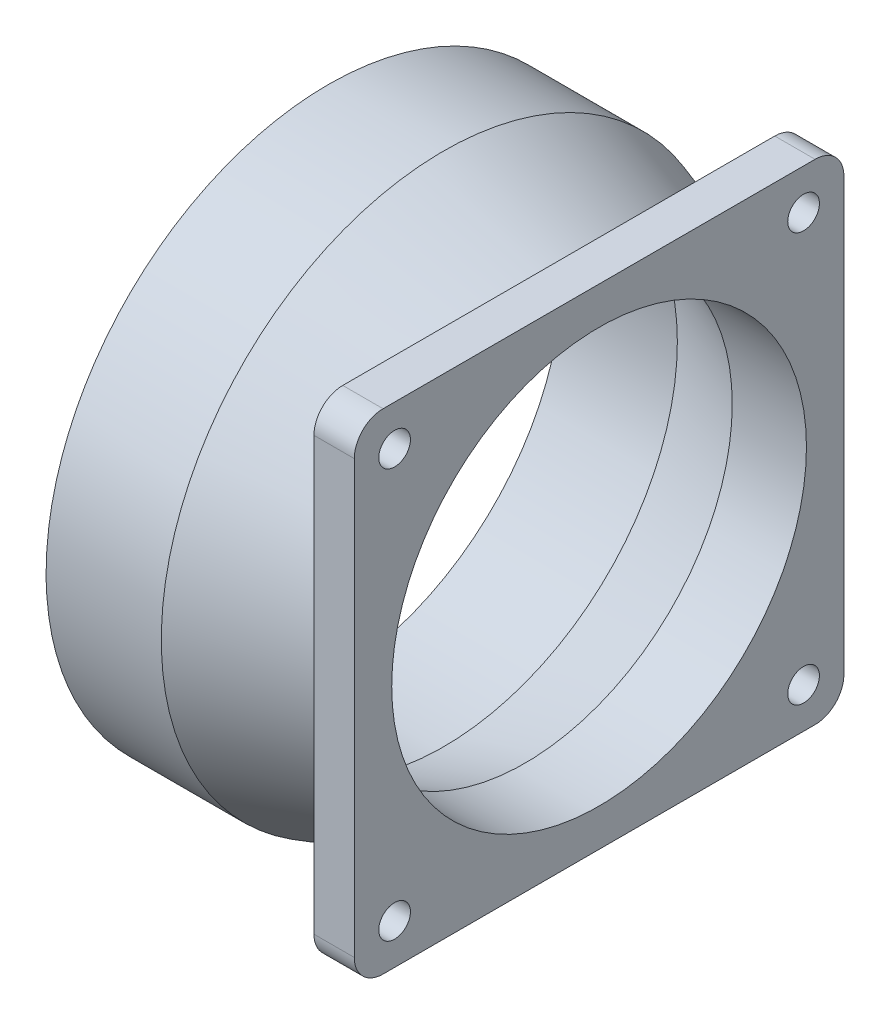
from build123d import *

# Parameters (mm, degrees)
SKETCH23_W          = 85
SKETCH23_H          = 85
BOSS_EXTRUDE1_DEPTH = 7
SKETCH26_R          = 49
SKETCH26_R_2        = 40.588103662
BOSS_EXTRUDE2_DEPTH = 20
SKETCH28_R          = 36
CUT_EXTRUDE5_DEPTH  = 84.731714422
SKETCH29_R          = 2.75
CUT_EXTRUDE6_DEPTH  = 7
FILLET1_R           = 5
FILLET2_R           = 5


# Read off the part's stored shape, not the designer's step: Loft-Thin1
with BuildPart() as part:
    # Loft-Thin1 outline → Loft-Thin1 (revolve)
    with BuildSketch(Plane.YX):
        Polygon((34.088103662, 20), (40.588103662, 0), (49, 0), (42.5, 20), align=None)
    revolve(axis=Axis((0, 0, 0), (1, 0, 0)))

    # Sketch23 → Boss-Extrude1 (add)
    with BuildSketch(Plane(origin=(20, 0, 0), x_dir=(0, 0, -1), z_dir=(1, 0, 0))):
        Rectangle(SKETCH23_W, SKETCH23_H)
    extrude(amount=BOSS_EXTRUDE1_DEPTH)

    # Sketch26 → Boss-Extrude2 (add)
    with BuildSketch(Plane.ZY):
        with Locations(Location((0, 0, 0), (0, 0, 180))):
            Circle(SKETCH26_R)
        with Locations(Location((0, 0, 0), (0, 0, 180))):
            Circle(SKETCH26_R_2, mode=Mode.SUBTRACT)
    extrude(amount=BOSS_EXTRUDE2_DEPTH)

    # Sketch28 → Cut-Extrude5 (cut, through all)
    with BuildSketch(Plane(origin=(27, 0, 0), x_dir=(0, 0, -1), z_dir=(1, 0, 0))):
        Circle(SKETCH28_R)
    extrude(amount=-CUT_EXTRUDE5_DEPTH, mode=Mode.SUBTRACT)

    # Sketch29 → Cut-Extrude6 (cut)
    with BuildSketch(Plane(origin=(27, 0, 0), x_dir=(0, 0, -1), z_dir=(1, 0, 0))):
        with Locations((-35.5, 35.5)):
            Circle(SKETCH29_R)
        with Locations(Location((35.5, 35.5, 0), (0, 0, 180))):
            Circle(SKETCH29_R)
        with Locations(Location((-35.5, -35.5, 0), (0, 0, 180))):
            Circle(SKETCH29_R)
        with Locations((35.5, -35.5)):
            Circle(SKETCH29_R)
    extrude(amount=-CUT_EXTRUDE6_DEPTH, mode=Mode.SUBTRACT)

    # Fillet1
    fillet1_edges = [part.edges().sort_by_distance(p)[0] for p in [
        (23.5, -42.5, -42.5),
    ]]
    fillet(fillet1_edges, radius=FILLET1_R)

    # Fillet2
    fillet2_edges = [part.edges().sort_by_distance(p)[0] for p in [
        (23.5, -42.5, 42.5),
        (23.5, 42.5, 42.5),
        (23.5, 42.5, -42.5),
    ]]
    fillet(fillet2_edges, radius=FILLET2_R)


solid = part.part
